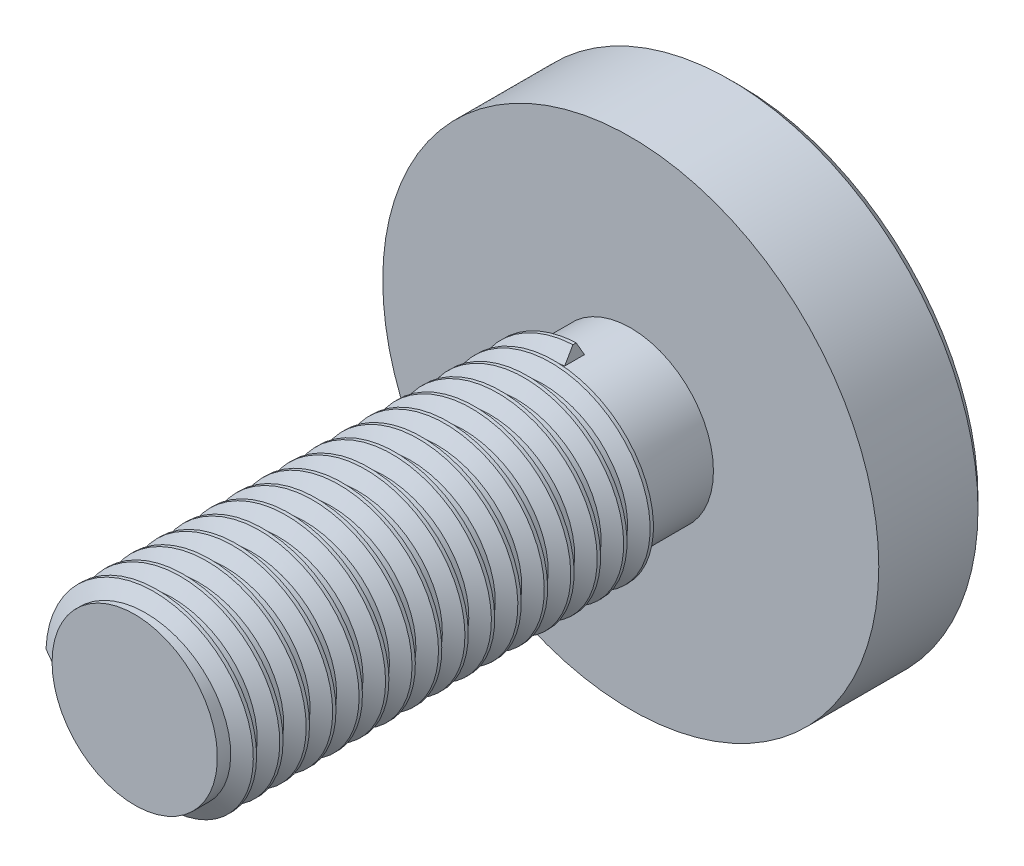
from build123d import *

# Parameters (mm, degrees)
SKETCH_1_R      = 7.5
EXTRUDE_1_DEPTH = 3.3
EXTRUDE_START   = 3.3
SKETCH_2_R      = 2.5
EXTRUDE_2_DEPTH = 15
THREAD_1_PITCH  = 0.8
CHAMFER_1_SIZE  = 0.3


with BuildPart() as part:
    # Sketch 1 → 凸台-拉伸1 (new body)
    with BuildSketch(Plane.XY):
        Circle(SKETCH_1_R)
    extrude(amount=EXTRUDE_1_DEPTH)

    # 草图2 → 凸台-拉伸2 (add)
    with BuildSketch(Plane.XY.offset(EXTRUDE_START)):
        Circle(SKETCH_2_R)
    extrude(amount=EXTRUDE_2_DEPTH)

    # 螺纹线1: the profile of Sketch 1 2 profile screwed along a right-hand helix of 16.25 turns, 8 arcs to a turn; built about Z, then put on its axis
    thread_1_z = Axis((0, 0, 0), (0, 0, 1))
    thread_1_corners = [(2.4997, 0, -0.000173205), (2.9330127, 0, 0.249999999), (2.9330127, 0, 0.349999999), (2.4997, 0, 0.600173203)]
    with BuildLine(mode=Mode.PRIVATE) as thread_1_profile:
        Line(thread_1_corners[0], thread_1_corners[1])
        Line(thread_1_corners[1], thread_1_corners[2])
        Line(thread_1_corners[2], thread_1_corners[3])
        Line(thread_1_corners[3], thread_1_corners[0])
    thread_1_cap = Face(thread_1_profile.wire())
    thread_1_turn_angles = [0, 22.5, 45, 67.5, 90, 112.5, 135, 157.5, 180, 202.5, 225, 247.5, 270, 292.5, 315, 337.5, 360]
    thread_1_turn_weights = [1, 0.9238795325112867, 1, 0.9238795325112867, 1, 0.9238795325112867, 1, 0.9238795325112867, 1, 0.9238795325112867, 1, 0.9238795325112867, 1, 0.9238795325112867, 1, 0.9238795325112867, 1]
    thread_1_turn_rails = [Edge.make_bspline([Vector(p[0], p[1], 0).rotate(thread_1_z, thread_1_turn_angles[k]) / thread_1_turn_weights[k] + Vector(0, 0, p[2] + THREAD_1_PITCH * thread_1_turn_angles[k] / 360) for k in range(17)], [0, 0, 0, 1, 1, 2, 2, 3, 3, 4, 4, 5, 5, 6, 6, 7, 7, 8, 8, 8], 2, thread_1_turn_weights) for p in thread_1_corners]
    thread_1_turn_sides = [Face.make_surface_from_curves(thread_1_turn_rails[p[0]], thread_1_turn_rails[p[1]]) for p in [(0, 1), (1, 2), (2, 3), (3, 0)]]
    thread_1_last_angles = [5760, 5782.5, 5805, 5827.5, 5850]
    thread_1_last_weights = [1, 0.9238795325112867, 1, 0.9238795325112867, 1]
    thread_1_last_rails = [Edge.make_bspline([Vector(p[0], p[1], 0).rotate(thread_1_z, thread_1_last_angles[k]) / thread_1_last_weights[k] + Vector(0, 0, p[2] + THREAD_1_PITCH * thread_1_last_angles[k] / 360) for k in range(5)], [0, 0, 0, 1, 1, 2, 2, 2], 2, thread_1_last_weights) for p in thread_1_corners]
    thread_1_last_sides = [Face.make_surface_from_curves(thread_1_last_rails[p[0]], thread_1_last_rails[p[1]]) for p in [(0, 1), (1, 2), (2, 3), (3, 0)]]
    thread_1 = Plane(origin=(0, 0, 18.3), x_dir=(-1, 0, 0), z_dir=(0, 0, -1)) * Solid(Shell([*[p.moved(Location((0, 0, THREAD_1_PITCH * i))) for i in range(16) for p in thread_1_turn_sides], *thread_1_last_sides, thread_1_cap, thread_1_cap.rotate(thread_1_z, 5850).moved(Location((0, 0, THREAD_1_PITCH * 5850 / 360)))]))
    add(thread_1)

    # 倒角1
    chamfer_1_edges = [part.edges().sort_by_distance(p)[0] for p in [
        (-7.5, 0, 0),
    ]]
    chamfer(chamfer_1_edges, length=CHAMFER_1_SIZE)


solid = part.part
